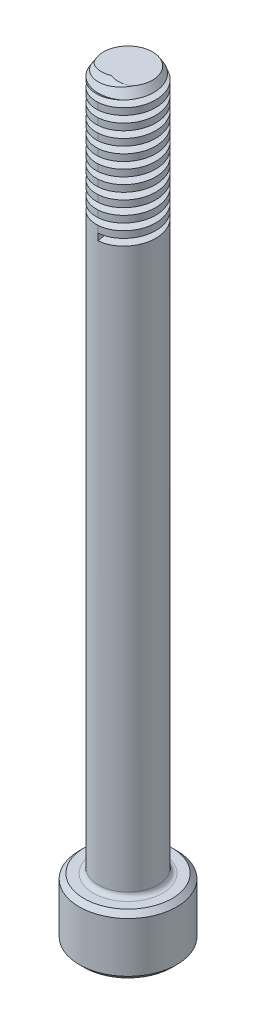
from build123d import *

# Parameters (mm, degrees)
CUT_SWEEP1_PITCH   = 0.635
CUT_EXTRUDE1_DEPTH = 1.2954
FILLET1_R          = 0.2286
FILLET2_R          = 0.396875794
CHAMFER2_SIZE      = 0.2286
CHAMFER3_SIZE      = 0.127


with BuildPart() as part:
    # Sketch1 → Revolve1 (revolve)
    with BuildSketch(Plane.XY, mode=Mode.PRIVATE) as revolve1_sk:
        Polygon((0, 0), (0, 36.1823), (1.4224, 36.1823), (1.4224, 2.8448), (2.3241, 2.8448), (2.3241, 0), align=None)
    revolve(revolve1_sk.sketch.rotate(Axis((0, 0, 0), (0, 1, 0)), 90), axis=Axis((0, 0, 0), (0, 1, 0)))

    # Cut-Sweep1: arcs per turn and ends read off the stored shape
    # Cut-Sweep1: the profile of Sketch3 profile screwed along a right-hand helix through 11 turns, 6 arcs to a turn; built about Z, then put on its axis
    cut_sweep1_z = Axis((0, 0, 0), (0, 0, 1))
    cut_sweep1_corners = [(1.4227, 0, -0.476175), (1.4227, 0, -0.793825), (0.78739873, 0, -0.635)]
    with BuildLine(mode=Mode.PRIVATE) as cut_sweep1_profile:
        Line(cut_sweep1_corners[0], cut_sweep1_corners[1])
        Line(cut_sweep1_corners[1], cut_sweep1_corners[2])
        Line(cut_sweep1_corners[2], cut_sweep1_corners[0])
    cut_sweep1_cap = Face(cut_sweep1_profile.wire())
    cut_sweep1_turn_angles = [0, 30, 60, 90, 120, 150, 180, 210, 240, 270, 300, 330, 360]
    cut_sweep1_turn_weights = [1, 0.8660254037844387, 1, 0.8660254037844387, 1, 0.8660254037844387, 1, 0.8660254037844387, 1, 0.8660254037844387, 1, 0.8660254037844387, 1]
    cut_sweep1_turn_rails = [Edge.make_bspline([Vector(p[0], p[1], 0).rotate(cut_sweep1_z, cut_sweep1_turn_angles[k]) / cut_sweep1_turn_weights[k] + Vector(0, 0, p[2] + CUT_SWEEP1_PITCH * cut_sweep1_turn_angles[k] / 360) for k in range(13)], [0, 0, 0, 1, 1, 2, 2, 3, 3, 4, 4, 5, 5, 6, 6, 6], 2, cut_sweep1_turn_weights) for p in cut_sweep1_corners]
    cut_sweep1_turn_sides = [Face.make_surface_from_curves(cut_sweep1_turn_rails[p[0]], cut_sweep1_turn_rails[p[1]]) for p in [(0, 1), (1, 2), (2, 0)]]
    cut_sweep1 = Plane(origin=(0, 36.1823, 0), x_dir=(0, 0, 1), z_dir=(0, -1, 0)) * Solid(Shell([*[p.moved(Location((0, 0, CUT_SWEEP1_PITCH * i))) for i in range(11) for p in cut_sweep1_turn_sides], cut_sweep1_cap, cut_sweep1_cap.rotate(cut_sweep1_z, 3960).moved(Location((0, 0, CUT_SWEEP1_PITCH * 3960 / 360)))]))
    add(cut_sweep1, mode=Mode.SUBTRACT)

    # Sketch4 → Cut-Extrude1 (cut)
    with BuildSketch(Plane(origin=(0, 0, 0), x_dir=(1, 0, 0), z_dir=(0, 1, 0))):
        Polygon((0, 1.378481503), (-1.1938, 0.689240751), (-1.1938, -0.689240751), (0, -1.378481503), (1.1938, -0.689240751), (1.1938, 0.689240751), align=None)
    extrude(amount=CUT_EXTRUDE1_DEPTH, mode=Mode.SUBTRACT)

    # Fillet1
    fillet1_edges = [part.edges().sort_by_distance(p)[0] for p in [
        (0, 2.8448, 1.4224),
    ]]
    fillet(fillet1_edges, radius=FILLET1_R)

    # Fillet2
    fillet2_edges = [part.edges().sort_by_distance(p)[0] for p in [
        (1.1938, 0.6477, -0.689240751),
        (0, 0.6477, -1.378481503),
        (-1.1938, 0.6477, -0.689240751),
        (-1.1938, 0.6477, 0.689240751),
        (0, 0.6477, 1.378481503),
        (1.1938, 0.6477, 0.689240751),
        (0.5969, 1.2954, -1.033861127),
        (-0.5969, 1.2954, -1.033861127),
        (-1.1938, 1.2954, 0),
        (-0.5969, 1.2954, 1.033861127),
        (0.5969, 1.2954, 1.033861127),
        (1.1938, 1.2954, 0),
    ]]
    fillet(fillet2_edges, radius=FILLET2_R)

    # Chamfer1: read off the stored shape, not the designer's step
    # Chamfer1 outline → Chamfer1 (revolve, cut)
    with BuildSketch(Plane.XY):
        Polygon((1.4224, 36.1823), (1.168399492, 36.1823), (1.4224, 35.770876279), align=None)
    revolve(axis=Axis((0, 0, 0), (0, 1, 0)), mode=Mode.SUBTRACT)

    # Chamfer2
    chamfer2_edges = [part.edges().sort_by_distance(p)[0] for p in [
        (0, 0, 2.3241),
        (0, 2.8448, 2.3241),
    ]]
    chamfer(chamfer2_edges, length=CHAMFER2_SIZE)

    # Chamfer3
    chamfer3_edges = [part.edges().sort_by_distance(p)[0] for p in [
        (0.5969, 0, -1.033861127),
        (-0.5969, 0, -1.033861127),
        (-1.1938, 0, 0),
        (-0.5969, 0, 1.033861127),
        (0.5969, 0, 1.033861127),
        (1.1938, 0, 0),
        (0, 0, -1.317084604),
        (1.140628726, 0, -0.658542302),
        (1.140628726, 0, 0.658542302),
        (0, 0, 1.317084604),
        (-1.140628726, 0, 0.658542302),
        (-1.140628726, 0, -0.658542302),
    ]]
    chamfer(chamfer3_edges, length=CHAMFER3_SIZE)


solid = part.part
